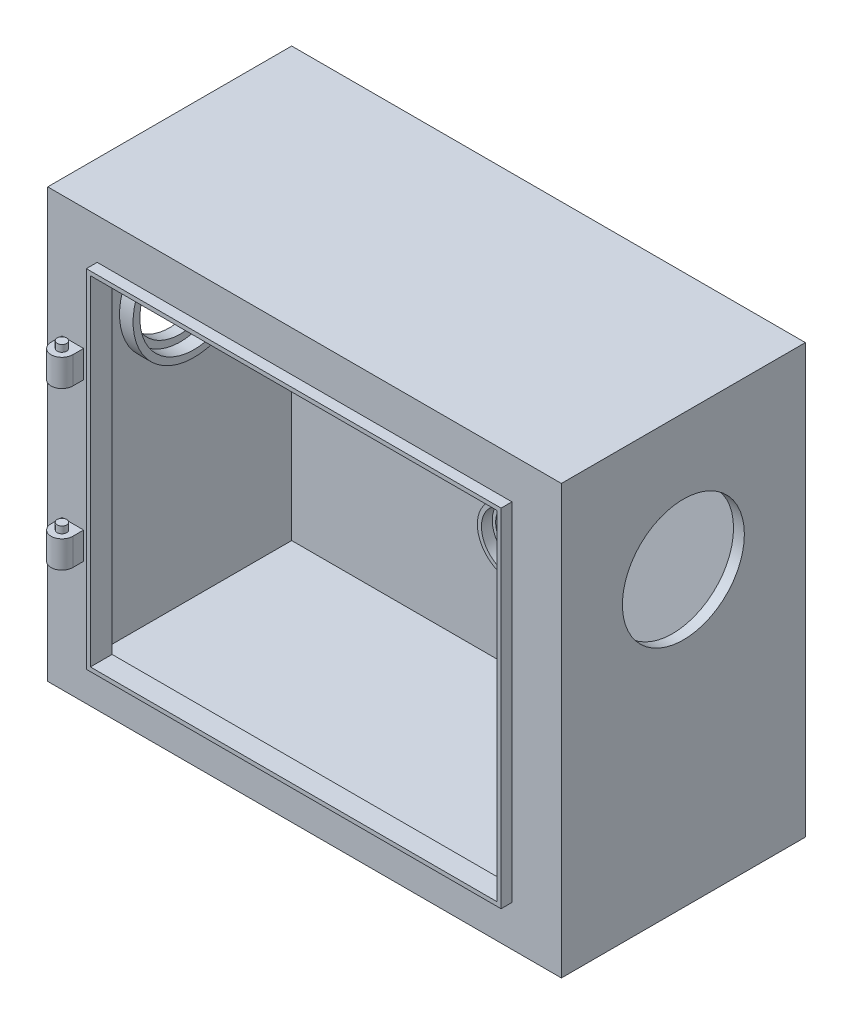
from build123d import *

# Parameters (mm, degrees)
CROQUIS1_W               = 379
CROQUIS1_H               = 316
SALIENTE_EXTRUIR1_DEPTH  = 180
VACIADO1_T               = -8
CROQUIS2_R               = 35
CORTAR_EXTRUIR4_DEPTH    = 20
CROQUIS4_R               = 45
CROQUIS4_R_2             = 40
SALIENTE_EXTRUIR4_DEPTH  = 10
CORTAR_EXTRUIR6_START    = -10
CROQUIS6_R               = 45
CORTAR_EXTRUIR6_DEPTH    = 10
CROQUIS7_R               = 24
CROQUIS7_R_2             = 21
SALIENTE_EXTRUIR9_DEPTH  = 18
CROQUIS11_W              = 363
CROQUIS11_H              = 300
CROQUIS11_W_2            = 300
CROQUIS11_H_2            = 250
SALIENTE_EXTRUIR10_DEPTH = 8
CROQUIS12_W              = 306
CROQUIS12_H              = 256
CROQUIS12_W_2            = 300
CROQUIS12_H_2            = 250
SALIENTE_EXTRUIR11_DEPTH = 8
CROQUIS13_W              = 16
CROQUIS13_H              = 20
SALIENTE_EXTRUIR13_DEPTH = 8
SALIENTE_EXTRUIR14_DEPTH = 20
CROQUIS15_R              = 3.5
SALIENTE_EXTRUIR15_DEPTH = 5
CROQUIS17_W              = 16
CROQUIS17_H              = 20
SALIENTE_EXTRUIR16_DEPTH = 8
SALIENTE_EXTRUIR17_DEPTH = 20
CROQUIS19_R              = 3.5
SALIENTE_EXTRUIR18_DEPTH = 5
CROQUIS20_R              = 21
CROQUIS20_R_2            = 18.5
SALIENTE_EXTRUIR19_DEPTH = 10


with BuildPart() as part:
    # Croquis1 → Saliente-Extruir1 (new body)
    with BuildSketch(Plane.XY):
        Rectangle(CROQUIS1_W, CROQUIS1_H)
    extrude(amount=SALIENTE_EXTRUIR1_DEPTH)

    # Vaciado1
    vaciado1_openings = [part.faces().sort_by_distance(p)[0] for p in [
        (0, 0, 180),
    ]]
    offset(amount=VACIADO1_T, openings=vaciado1_openings, kind=Kind.INTERSECTION)

    # Croquis2 → Cortar-Extruir4 (cut)
    with BuildSketch(Plane.ZY.offset(189.5)):
        with Locations((90, 58)):
            Circle(CROQUIS2_R)
    extrude(amount=-CORTAR_EXTRUIR4_DEPTH, mode=Mode.SUBTRACT)

    # Croquis4 → Saliente-Extruir4 (add)
    with BuildSketch(Plane(origin=(-181.5, 0, 0), x_dir=(0, 0, -1), z_dir=(1, 0, 0))):
        with Locations((-90, 58)):
            Circle(CROQUIS4_R)
        with Locations((-90, 58)):
            Circle(CROQUIS4_R_2, mode=Mode.SUBTRACT)
    extrude(amount=SALIENTE_EXTRUIR4_DEPTH)

    # Croquis6 → Cortar-Extruir6 (cut)
    with BuildSketch(Plane(origin=(189.5, 0, 0), x_dir=(0, 0, -1), z_dir=(1, 0, 0)).offset(CORTAR_EXTRUIR6_START)):
        with Locations((-90, 58)):
            Circle(CROQUIS6_R)
    extrude(amount=CORTAR_EXTRUIR6_DEPTH, mode=Mode.SUBTRACT)

    # Croquis7 → Saliente-Extruir9 (add)
    with BuildSketch(Plane.XY.offset(8)):
        with Locations((-2.5, -53)):
            Circle(CROQUIS7_R)
        with Locations((-2.5, -53)):
            Circle(CROQUIS7_R_2, mode=Mode.SUBTRACT)
    extrude(amount=SALIENTE_EXTRUIR9_DEPTH)

    # Croquis11 → Saliente-Extruir10 (add)
    with BuildSketch(Plane.XY.offset(180)):
        Rectangle(CROQUIS11_W, CROQUIS11_H)
        Rectangle(CROQUIS11_W_2, CROQUIS11_H_2, mode=Mode.SUBTRACT)
    extrude(amount=-SALIENTE_EXTRUIR10_DEPTH)

    # Croquis12 → Saliente-Extruir11 (add)
    with BuildSketch(Plane.XY.offset(180)):
        Rectangle(CROQUIS12_W, CROQUIS12_H)
        Rectangle(CROQUIS12_W_2, CROQUIS12_H_2, mode=Mode.SUBTRACT)
    extrude(amount=SALIENTE_EXTRUIR11_DEPTH)

    # Croquis13 → Saliente-Extruir13 (add)
    with BuildSketch(Plane.XY.offset(180)):
        with Locations((-171, 58)):
            Rectangle(CROQUIS13_W, CROQUIS13_H)
    extrude(amount=SALIENTE_EXTRUIR13_DEPTH)

    # Croquis14 → Saliente-Extruir14 (add)
    with BuildSketch(Plane(origin=(0, 68, 0), x_dir=(1, 0, 0), z_dir=(0, 1, 0))):
        with BuildLine():
            Line((-179, -188), (-163, -188))
            ThreePointArc((-163, -188), (-171, -196), (-179, -188))
        make_face()
    extrude(amount=-SALIENTE_EXTRUIR14_DEPTH)

    # Croquis15 → Saliente-Extruir15 (add)
    with BuildSketch(Plane(origin=(0, 68, 0), x_dir=(1, 0, 0), z_dir=(0, 1, 0))):
        with Locations((-171, -188)):
            Circle(CROQUIS15_R)
    extrude(amount=SALIENTE_EXTRUIR15_DEPTH)

    # Croquis17 → Saliente-Extruir16 (add)
    with BuildSketch(Plane.XY.offset(180)):
        with Locations((-171, -58)):
            Rectangle(CROQUIS17_W, CROQUIS17_H)
    extrude(amount=SALIENTE_EXTRUIR16_DEPTH)

    # Croquis18 → Saliente-Extruir17 (add)
    with BuildSketch(Plane(origin=(0, -48, 0), x_dir=(1, 0, 0), z_dir=(0, 1, 0))):
        with BuildLine():
            Line((-179, -188), (-163, -188))
            ThreePointArc((-163, -188), (-171, -196), (-179, -188))
        make_face()
    extrude(amount=-SALIENTE_EXTRUIR17_DEPTH)

    # Croquis19 → Saliente-Extruir18 (add)
    with BuildSketch(Plane(origin=(0, -48, 0), x_dir=(1, 0, 0), z_dir=(0, 1, 0))):
        with Locations((-171, -188)):
            Circle(CROQUIS19_R)
    extrude(amount=SALIENTE_EXTRUIR18_DEPTH)

    # Croquis20 → Saliente-Extruir19 (add)
    with BuildSketch(Plane.XY.offset(8)):
        with Locations((-2.5, -53)):
            Circle(CROQUIS20_R)
        with Locations((-2.5, -53)):
            Circle(CROQUIS20_R_2, mode=Mode.SUBTRACT)
    extrude(amount=SALIENTE_EXTRUIR19_DEPTH)


solid = part.part
